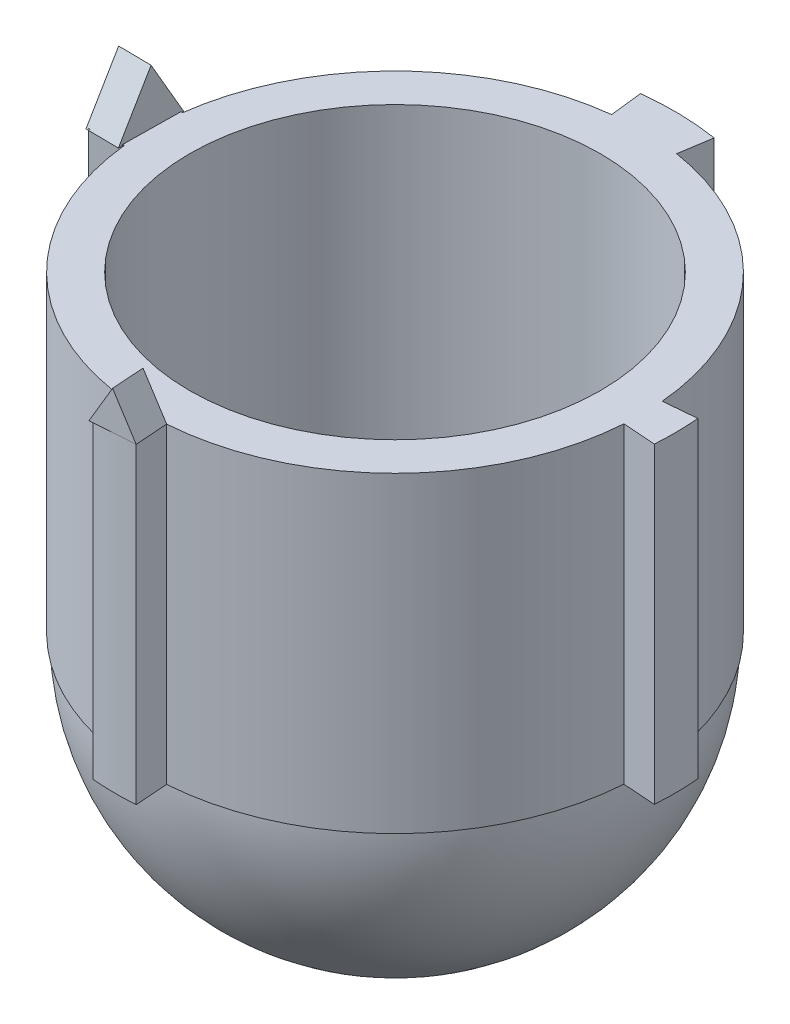
from build123d import *

# Parameters (mm, degrees)
SKETCH1_R           = 12.5
BOSS_EXTRUDE1_DEPTH = 19
REVOLVE_THIN8_ANGLE = 180
BOSS_EXTRUDE4_DEPTH = 2
BOSS_EXTRUDE5_DEPTH = 2


# Read off the part's stored shape, not the designer's step: Revolve-Thin8
with BuildPart() as part:
    # Sketch1 → Boss-Extrude1 (new body)
    with BuildSketch(Plane(origin=(0, 0, 0), x_dir=(1, 0, 0), z_dir=(0, 1, 0))):
        with BuildLine():
            Line((-16.857907097, 2.193391967), (-14.874623909, 1.935345853))
            ThreePointArc((-14.874623909, 1.935345853), (-10.527218249, 10.68539545), (-1.713310211, 14.901831032))
            Line((-1.713310211, 14.901831032), (-1.941751573, 16.888741837))
            ThreePointArc((-1.941751573, 16.888741837), (0.351548962, 16.996364709), (2.638437912, 16.794006234))
            Line((2.638437912, 16.794006234), (2.328033452, 14.818240795))
            ThreePointArc((2.328033452, 14.818240795), (10.955949894, 10.245348306), (14.940866835, 1.330600703))
            Line((14.940866835, 1.330600703), (16.932982413, 1.50801413))
            ThreePointArc((16.932982413, 1.50801413), (16.999139456, 0.171049014), (16.959898748, -1.166976638))
            Line((16.959898748, -1.166976638), (14.964616542, -1.029685269))
            ThreePointArc((14.964616542, -1.029685269), (10.617208635, -10.595984183), (1.059628295, -14.962526119))
            Line((1.059628295, -14.962526119), (1.200912068, -16.957529602))
            ThreePointArc((1.200912068, -16.957529602), (-0.131031268, -16.999495016), (-1.462169449, -16.937002701))
            Line((-1.462169449, -16.937002701), (-1.290149514, -14.944414148))
            ThreePointArc((-1.290149514, -14.944414148), (-10.511046509, -10.701303719), (-14.91886862, -1.557998423))
            Line((-14.91886862, -1.557998423), (-16.908051103, -1.765731546))
            ThreePointArc((-16.908051103, -1.765731546), (-16.998636652, 0.215295063), (-16.857907097, 2.193391967))
        make_face()
        with Locations(Location((0, 0, 0), (0, 0, 270))):
            Circle(SKETCH1_R, mode=Mode.SUBTRACT)
    extrude(amount=BOSS_EXTRUDE1_DEPTH)

    # Revolve-Thin8 outline → Revolve-Thin8 (revolve)
    with BuildSketch(Plane.ZX):
        with BuildLine():
            ThreePointArc((0, -14.874623909), (14.874623909, 0), (0, 14.874623909))
            Line((0, 14.874623909), (0, -14.874623909))
        make_face()
        with BuildLine():
            Line((5, -8.515174534), (5, 8.515174534))
            ThreePointArc((5, 8.515174534), (9.874623909, 0), (5, -8.515174534))
        make_face(mode=Mode.SUBTRACT)
    revolve(axis=Axis((0, 0, 0), (1, 0, 0)), revolution_arc=REVOLVE_THIN8_ANGLE)

    # Sketch6 → Boss-Extrude4 (add)
    with BuildSketch(Plane(origin=(1.200912068, 9.5, 16.957529602), x_dir=(0.9975017412997444, 0, -0.0706418863279974), z_dir=(0.0706418863279974, 0, 0.9975017412997444))):
        Polygon((0, 9.5), (-1.345294106, 11.830117743), (-2.690588212, 9.5), align=None)
    extrude(amount=-BOSS_EXTRUDE4_DEPTH)

    # Sketch7 → Boss-Extrude5 (add)
    with BuildSketch(Plane(origin=(-16.998636652, 0, -0.215295063), x_dir=(-0.012664415486466005, 0, 0.9999198030744196), z_dir=(-0.9999198030744197, 0, -0.012664415486466006))):
        Polygon((-1.921412098, 18.937041844), (2.005099018, 18.937041844), (0.04184346, 22.337500219), align=None)
    extrude(amount=-BOSS_EXTRUDE5_DEPTH)


solid = part.part
